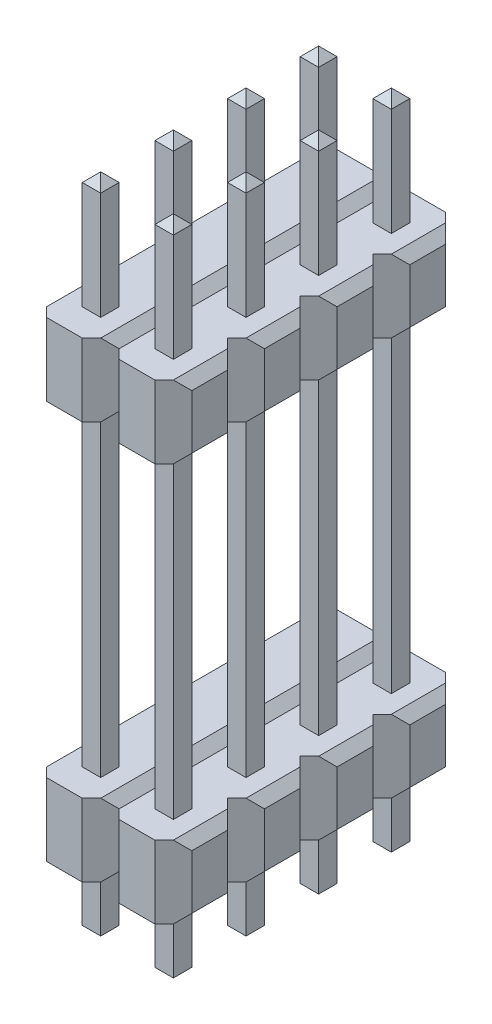
from build123d import *

# Parameters (mm, degrees)
SKETCH1_W                  = 1.99898
SKETCH1_H                  = 1.99898
BASE_EXTRUDE_DEPTH         = 1.99898
CHAMFER1_SIZE              = 0.254
CHAMFER2_SIZE              = 0.254
CHAMFER3_SIZE              = 0.508
CHAMFER4_SIZE              = 0.508
BOSS_EXTRUDE1_START        = -2.032
SKETCH2_W                  = 0.508
SKETCH2_H                  = 0.508
BOSS_EXTRUDE1_DEPTH        = 18.2118
LPATTERN1_START            = -6.99643
LPATTERN1_DEPTH            = 5.99694
LPATTERN1_START_2          = -0.99949
LPATTERN1_2_DEPTH          = 1.99898
LPATTERN1_START_3          = 2.467774382
LPATTERN1_3_OUTLINE_W      = 1.413492313
LPATTERN1_3_OUTLINE_H      = 1.99898
LPATTERN1_3_OUTLINE_W_2    = 0.718420489
LPATTERN1_3_DEPTH          = 0.71842049
LPATTERN1_START_4          = 0.359210245
LPATTERN1_4_OUTLINE_W      = 1.532225618
LPATTERN1_4_OUTLINE_H      = 1.99898
LPATTERN1_4_OUTLINE_W_2    = 1.705240991
LPATTERN1_4_DEPTH          = 4.24047694
LPATTERN1_START_5          = 5.294759009
LPATTERN1_5_OUTLINE_W      = 0.718420489
LPATTERN1_5_OUTLINE_H      = 1.99898
LPATTERN1_5_OUTLINE_W_2    = 1.413492313
LPATTERN1_5_DEPTH          = 1.413492313
LPATTERN1_START_6          = 1.054282069
LPATTERN1_6_OUTLINE_W      = 0.71842049
LPATTERN1_6_OUTLINE_H      = 1.99898
LPATTERN1_6_DEPTH          = 0.718420489
LPATTERN1_START_7          = 3.881266696
LPATTERN1_7_OUTLINE_W      = 0.71842049
LPATTERN1_7_OUTLINE_H      = 1.99898
LPATTERN1_7_DEPTH          = 0.718420489
LPATTERN1_START_8          = -1.054282069
LPATTERN1_8_OUTLINE_W      = 1.413492313
LPATTERN1_8_OUTLINE_H      = 1.99898
LPATTERN1_8_OUTLINE_W_2    = 0.718420489
LPATTERN1_8_DEPTH          = 1.413492314
LPATTERN1_START_9          = 6.708251322
LPATTERN1_9_OUTLINE_W      = 0.71842049
LPATTERN1_9_OUTLINE_H      = 1.99898
LPATTERN1_9_DEPTH          = 1.291748678
CHAMFER5_SIZE              = 0.254
LPATTERN2_COUNT            = 2
LPATTERN2_PITCH            = 1.99898
LPATTERN2_COUNT_DIR2       = 4
LPATTERN2_PITCH_DIR2       = 1.99898
CHAMFER5_OF_LPATTERN2_SIZE = 0.254
LPATTERN4_START            = -6.99643
LPATTERN4_DEPTH            = 7.99592
LPATTERN4_START_2          = -1.772702558
LPATTERN4_2_OUTLINE_W      = 1.413492314
LPATTERN4_2_OUTLINE_H      = 1.99898
LPATTERN4_2_OUTLINE_W_2    = 0.71842049
LPATTERN4_2_OUTLINE_W_3    = 1.413492313
LPATTERN4_2_DEPTH          = 0.718420489
LPATTERN4_START_3          = -0.359210245
LPATTERN4_3_OUTLINE_W      = 1.945717931
LPATTERN4_3_OUTLINE_H      = 1.99898
LPATTERN4_3_OUTLINE_W_2    = 0.718420489
LPATTERN4_3_DEPTH          = 0.71842049
LPATTERN4_START_4          = -3.186194872
LPATTERN4_4_OUTLINE_W      = 0.718420489
LPATTERN4_4_OUTLINE_H      = 1.99898
LPATTERN4_4_OUTLINE_W_2    = 1.291748678
LPATTERN4_4_DEPTH          = 0.71842049
LPATTERN4_START_5          = -5.294759009
LPATTERN4_5_OUTLINE_W      = 0.71842049
LPATTERN4_5_OUTLINE_H      = 1.99898
LPATTERN4_5_OUTLINE_W_2    = 1.413492313
LPATTERN4_5_DEPTH          = 1.413492313
LPATTERN4_START_6          = 1.054282069
LPATTERN4_6_OUTLINE_W      = 1.413492314
LPATTERN4_6_OUTLINE_H      = 1.99898
LPATTERN4_6_OUTLINE_W_2    = 0.71842049
LPATTERN4_6_DEPTH          = 1.413492313
LPATTERN4_START_7          = -7
LPATTERN4_7_OUTLINE_W      = 0.718420489
LPATTERN4_7_OUTLINE_H      = 1.99898
LPATTERN4_7_DEPTH          = 1.705240991
LPATTERN4_START_8          = 2.467774382
LPATTERN4_8_OUTLINE_W      = 0.718420489
LPATTERN4_8_OUTLINE_H      = 1.99898
LPATTERN4_8_DEPTH          = 1.532225618


with BuildPart() as part:
    # Sketch1 → Base-Extrude (new body)
    with BuildSketch(Plane(origin=(0, 0, 0), x_dir=(1, 0, 0), z_dir=(0, 1, 0))):
        Rectangle(SKETCH1_W, SKETCH1_H)
    extrude(amount=BASE_EXTRUDE_DEPTH)

    # Chamfer1
    chamfer1_edges = [part.edges().sort_by_distance(p)[0] for p in [
        (0.99949, 1.99898, 0),
        (-0.99949, 1.99898, 0),
    ]]
    chamfer(chamfer1_edges, length=CHAMFER1_SIZE)

    # Chamfer2
    chamfer2_edges = [part.edges().sort_by_distance(p)[0] for p in [
        (0.99949, 0, 0),
        (-0.99949, 0, 0),
    ]]
    chamfer(chamfer2_edges, length=CHAMFER2_SIZE)

    # Chamfer3
    chamfer3_edges = [part.edges().sort_by_distance(p)[0] for p in [
        (0.99949, 0.99949, 0.99949),
        (-0.99949, 0.99949, 0.99949),
    ]]
    chamfer(chamfer3_edges, length=CHAMFER3_SIZE)

    # Chamfer4
    chamfer4_edges = [part.edges().sort_by_distance(p)[0] for p in [
        (-0.99949, 0.99949, -0.99949),
        (0.99949, 0.99949, -0.99949),
    ]]
    chamfer(chamfer4_edges, length=CHAMFER4_SIZE)

    # Sketch2 → Boss-Extrude1 (add)
    with BuildSketch(Plane(origin=(0, 0, 0), x_dir=(-1, 0, 0), z_dir=(0, 1, 0)).offset(BOSS_EXTRUDE1_START)):
        Rectangle(SKETCH2_W, SKETCH2_H)
    boss_extrude1 = extrude(amount=BOSS_EXTRUDE1_DEPTH)

    # LPattern1: read off the stored shape, not the designer's step
    # LPattern1 outline → LPattern1 (add)
    with BuildSketch(Plane.XY.offset(LPATTERN1_START)):
        Polygon((-0.99949, 1.74498), (-0.99949, 0.254), (-0.74549, 0), (0.74549, 0), (0.99949, 0.254), (1.25349, 0), (2.74447, 0), (2.99847, 0.254), (2.99847, 1.74498), (2.74447, 1.99898), (1.25349, 1.99898), (0.99949, 1.74498), (0.74549, 1.99898), (-0.74549, 1.99898), align=None)
    extrude(amount=LPATTERN1_DEPTH)

    # LPattern1 2 outline → LPattern1 2 (add)
    with BuildSketch(Plane.XY.offset(LPATTERN1_START_2)):
        Polygon((0.99949, 1.74498), (0.99949, 0.254), (1.25349, 0), (2.74447, 0), (2.99847, 0.254), (2.99847, 1.74498), (2.74447, 1.99898), (1.25349, 1.99898), align=None)
    extrude(amount=LPATTERN1_2_DEPTH)

    # LPattern1 3 outline → LPattern1 3 (cut)
    with BuildSketch(Plane(origin=(0, 0, 0), x_dir=(0.707106781186548, 0, 0.707106781186547), z_dir=(0.707106781186547, 0, -0.707106781186548)).offset(LPATTERN1_START_3)):
        with Locations((1.761028226, -0.99949)):
            Rectangle(LPATTERN1_3_OUTLINE_W, LPATTERN1_3_OUTLINE_H)
        with Locations((-1.413492314, -0.99949)):
            Rectangle(LPATTERN1_3_OUTLINE_W_2, LPATTERN1_3_OUTLINE_H)
        with Locations((-4.588012853, -0.99949)):
            Rectangle(LPATTERN1_3_OUTLINE_W, LPATTERN1_3_OUTLINE_H)
    extrude(amount=LPATTERN1_3_DEPTH, mode=Mode.SUBTRACT)

    # LPattern1 4 outline → LPattern1 4 (cut)
    with BuildSketch(Plane(origin=(0, 0, 0), x_dir=(0.707106781186548, 0, 0.707106781186547), z_dir=(0.707106781186547, 0, -0.707106781186548)).offset(LPATTERN1_START_4)):
        with Locations((3.233887191, -0.99949)):
            Rectangle(LPATTERN1_4_OUTLINE_W, LPATTERN1_4_OUTLINE_H)
        with Locations((-6.147379504, -0.99949)):
            Rectangle(LPATTERN1_4_OUTLINE_W_2, LPATTERN1_4_OUTLINE_H)
    extrude(amount=LPATTERN1_4_DEPTH, mode=Mode.SUBTRACT)

    # LPattern1 5 outline → LPattern1 5 (cut)
    with BuildSketch(Plane(origin=(0, 0, 0), x_dir=(0.707106781186548, 0, 0.707106781186547), z_dir=(0.707106781186547, 0, -0.707106781186548)).offset(LPATTERN1_START_5)):
        with Locations((-1.413492314, -0.99949)):
            Rectangle(LPATTERN1_5_OUTLINE_W, LPATTERN1_5_OUTLINE_H)
        with Locations((-4.588012853, -0.99949)):
            Rectangle(LPATTERN1_5_OUTLINE_W_2, LPATTERN1_5_OUTLINE_H)
    extrude(amount=LPATTERN1_5_DEPTH, mode=Mode.SUBTRACT)

    # LPattern1 6 outline → LPattern1 6 (cut)
    with BuildSketch(Plane(origin=(0, 0, 0), x_dir=(0.707106781186548, 0, 0.707106781186547), z_dir=(0.707106781186547, 0, -0.707106781186548)).offset(LPATTERN1_START_6)):
        with Locations((0, -0.99949)):
            Rectangle(LPATTERN1_6_OUTLINE_W, LPATTERN1_6_OUTLINE_H)
        with Locations((-2.826984627, -0.99949)):
            Rectangle(LPATTERN1_6_OUTLINE_W, LPATTERN1_6_OUTLINE_H)
    extrude(amount=LPATTERN1_6_DEPTH, mode=Mode.SUBTRACT)

    # LPattern1 7 outline → LPattern1 7 (cut)
    with BuildSketch(Plane(origin=(0, 0, 0), x_dir=(0.707106781186548, 0, 0.707106781186547), z_dir=(0.707106781186547, 0, -0.707106781186548)).offset(LPATTERN1_START_7)):
        with Locations((0, -0.99949)):
            Rectangle(LPATTERN1_7_OUTLINE_W, LPATTERN1_7_OUTLINE_H)
        with Locations((-2.826984627, -0.99949)):
            Rectangle(LPATTERN1_7_OUTLINE_W, LPATTERN1_7_OUTLINE_H)
    extrude(amount=LPATTERN1_7_DEPTH, mode=Mode.SUBTRACT)

    # LPattern1 8 outline → LPattern1 8 (cut)
    with BuildSketch(Plane(origin=(0, 0, 0), x_dir=(0.707106781186548, 0, 0.707106781186547), z_dir=(0.707106781186547, 0, -0.707106781186548)).offset(LPATTERN1_START_8)):
        with Locations((1.761028226, -0.99949)):
            Rectangle(LPATTERN1_8_OUTLINE_W, LPATTERN1_8_OUTLINE_H)
        with Locations((-1.413492314, -0.99949)):
            Rectangle(LPATTERN1_8_OUTLINE_W_2, LPATTERN1_8_OUTLINE_H)
    extrude(amount=LPATTERN1_8_DEPTH, mode=Mode.SUBTRACT)

    # LPattern1 9 outline → LPattern1 9 (cut)
    with BuildSketch(Plane(origin=(0, 0, 0), x_dir=(0.707106781186548, 0, 0.707106781186547), z_dir=(0.707106781186547, 0, -0.707106781186548)).offset(LPATTERN1_START_9)):
        with Locations((-2.826984627, -0.99949)):
            Rectangle(LPATTERN1_9_OUTLINE_W, LPATTERN1_9_OUTLINE_H)
    extrude(amount=LPATTERN1_9_DEPTH, mode=Mode.SUBTRACT)

    # Chamfer5
    chamfer5_edges = [part.edges().sort_by_distance(p)[0] for p in [
        (-0.254, -2.032, 0),
        (0, -2.032, -0.254),
        (0.254, -2.032, 0),
        (0, -2.032, 0.254),
        (-0.254, 16.1798, 0),
        (0, 16.1798, 0.254),
        (0.254, 16.1798, 0),
        (0, 16.1798, -0.254),
    ]]
    chamfer(chamfer5_edges, length=CHAMFER5_SIZE - 0.0001)  # a hair under: the kernel refuses the full size

    # LPattern2: Boss-Extrude1 2 × 4
    with Locations(*[(i * LPATTERN2_PITCH, 0, -j * LPATTERN2_PITCH_DIR2) for i in range(LPATTERN2_COUNT) for j in range(LPATTERN2_COUNT_DIR2) if (i, j) != (0, 0)]):
        add(boss_extrude1)

    # Chamfer5 of LPattern2
    chamfer5_of_lpattern2_edges = [part.edges().sort_by_distance(p)[0] for p in [
        (-0.254, -2.032, -1.99898),
        (0, -2.032, -2.25298),
        (0.254, -2.032, -1.99898),
        (0, -2.032, -1.74498),
        (-0.254, 16.1798, -1.99898),
        (0, 16.1798, -1.74498),
        (0.254, 16.1798, -1.99898),
        (0, 16.1798, -2.25298),
        (-0.254, -2.032, -3.99796),
        (0, -2.032, -4.25196),
        (0.254, -2.032, -3.99796),
        (0, -2.032, -3.74396),
        (-0.254, 16.1798, -3.99796),
        (0, 16.1798, -3.74396),
        (0.254, 16.1798, -3.99796),
        (0, 16.1798, -4.25196),
        (-0.254, -2.032, -5.99694),
        (0, -2.032, -6.25094),
        (0.254, -2.032, -5.99694),
        (0, -2.032, -5.74294),
        (-0.254, 16.1798, -5.99694),
        (0, 16.1798, -5.74294),
        (0.254, 16.1798, -5.99694),
        (0, 16.1798, -6.25094),
        (1.74498, -2.032, 0),
        (1.99898, -2.032, -0.254),
        (2.25298, -2.032, 0),
        (1.99898, -2.032, 0.254),
        (1.74498, 16.1798, 0),
        (1.99898, 16.1798, 0.254),
        (2.25298, 16.1798, 0),
        (1.99898, 16.1798, -0.254),
        (1.74498, -2.032, -1.99898),
        (1.99898, -2.032, -2.25298),
        (2.25298, -2.032, -1.99898),
        (1.99898, -2.032, -1.74498),
        (1.74498, 16.1798, -1.99898),
        (1.99898, 16.1798, -1.74498),
        (2.25298, 16.1798, -1.99898),
        (1.99898, 16.1798, -2.25298),
        (1.74498, -2.032, -3.99796),
        (1.99898, -2.032, -4.25196),
        (2.25298, -2.032, -3.99796),
        (1.99898, -2.032, -3.74396),
        (1.74498, 16.1798, -3.99796),
        (1.99898, 16.1798, -3.74396),
        (2.25298, 16.1798, -3.99796),
        (1.99898, 16.1798, -4.25196),
        (1.74498, -2.032, -5.99694),
        (1.99898, -2.032, -6.25094),
        (2.25298, -2.032, -5.99694),
        (1.99898, -2.032, -5.74294),
        (1.74498, 16.1798, -5.99694),
        (1.99898, 16.1798, -5.74294),
        (2.25298, 16.1798, -5.99694),
        (1.99898, 16.1798, -6.25094),
    ]]
    chamfer(chamfer5_of_lpattern2_edges, length=CHAMFER5_OF_LPATTERN2_SIZE - 0.0001)  # a hair under: the kernel refuses the full size

    # LPattern4: read off the stored shape, not the designer's step
    # LPattern4 outline → LPattern4 (add)
    with BuildSketch(Plane.XY.offset(LPATTERN4_START)):
        Polygon((-0.99949, 12.71016), (-0.99949, 11.21918), (-0.74549, 10.96518), (0.74549, 10.96518), (0.99949, 11.21918), (1.25349, 10.96518), (2.74447, 10.96518), (2.99847, 11.21918), (2.99847, 12.71016), (2.74447, 12.96416), (1.25349, 12.96416), (0.99949, 12.71016), (0.74549, 12.96416), (-0.74549, 12.96416), align=None)
    extrude(amount=LPATTERN4_DEPTH)

    # LPattern4 2 outline → LPattern4 2 (cut)
    with BuildSketch(Plane(origin=(0, 0, 0), x_dir=(0.7071067811865471, 0, -0.707106781186548), z_dir=(0.707106781186548, 0, 0.707106781186547)).offset(LPATTERN4_START_2)):
        with Locations((-0.347535912, 11.96467)):
            Rectangle(LPATTERN4_2_OUTLINE_W, LPATTERN4_2_OUTLINE_H)
        with Locations((2.826984627, 11.96467)):
            Rectangle(LPATTERN4_2_OUTLINE_W_2, LPATTERN4_2_OUTLINE_H)
        with Locations((6.001505166, 11.96467)):
            Rectangle(LPATTERN4_2_OUTLINE_W_3, LPATTERN4_2_OUTLINE_H)
    extrude(amount=LPATTERN4_2_DEPTH, mode=Mode.SUBTRACT)

    # LPattern4 3 outline → LPattern4 3 (cut)
    with BuildSketch(Plane(origin=(0, 0, 0), x_dir=(0.7071067811865471, 0, -0.707106781186548), z_dir=(0.707106781186548, 0, 0.707106781186547)).offset(LPATTERN4_START_3)):
        with Locations((-2.027141035, 11.96467)):
            Rectangle(LPATTERN4_3_OUTLINE_W, LPATTERN4_3_OUTLINE_H)
        with Locations((1.413492314, 11.96467)):
            Rectangle(LPATTERN4_3_OUTLINE_W_2, LPATTERN4_3_OUTLINE_H)
        with Locations((4.240476941, 11.96467)):
            Rectangle(LPATTERN4_3_OUTLINE_W_2, LPATTERN4_3_OUTLINE_H)
    extrude(amount=LPATTERN4_3_DEPTH, mode=Mode.SUBTRACT)

    # LPattern4 4 outline → LPattern4 4 (cut)
    with BuildSketch(Plane(origin=(0, 0, 0), x_dir=(0.7071067811865471, 0, -0.707106781186548), z_dir=(0.707106781186548, 0, 0.707106781186547)).offset(LPATTERN4_START_4)):
        with Locations((1.413492314, 11.96467)):
            Rectangle(LPATTERN4_4_OUTLINE_W, LPATTERN4_4_OUTLINE_H)
        with Locations((4.240476941, 11.96467)):
            Rectangle(LPATTERN4_4_OUTLINE_W, LPATTERN4_4_OUTLINE_H)
        with Locations((7.354125661, 11.96467)):
            Rectangle(LPATTERN4_4_OUTLINE_W_2, LPATTERN4_4_OUTLINE_H)
    extrude(amount=LPATTERN4_4_DEPTH, mode=Mode.SUBTRACT)

    # LPattern4 5 outline → LPattern4 5 (cut)
    with BuildSketch(Plane(origin=(0, 0, 0), x_dir=(0.7071067811865471, 0, -0.707106781186548), z_dir=(0.707106781186548, 0, 0.707106781186547)).offset(LPATTERN4_START_5)):
        with Locations((2.826984627, 11.96467)):
            Rectangle(LPATTERN4_5_OUTLINE_W, LPATTERN4_5_OUTLINE_H)
        with Locations((6.001505166, 11.96467)):
            Rectangle(LPATTERN4_5_OUTLINE_W_2, LPATTERN4_5_OUTLINE_H)
    extrude(amount=LPATTERN4_5_DEPTH, mode=Mode.SUBTRACT)

    # LPattern4 6 outline → LPattern4 6 (cut)
    with BuildSketch(Plane(origin=(0, 0, 0), x_dir=(0.7071067811865471, 0, -0.707106781186548), z_dir=(0.707106781186548, 0, 0.707106781186547)).offset(LPATTERN4_START_6)):
        with Locations((-0.347535912, 11.96467)):
            Rectangle(LPATTERN4_6_OUTLINE_W, LPATTERN4_6_OUTLINE_H)
        with Locations((2.826984627, 11.96467)):
            Rectangle(LPATTERN4_6_OUTLINE_W_2, LPATTERN4_6_OUTLINE_H)
    extrude(amount=LPATTERN4_6_DEPTH, mode=Mode.SUBTRACT)

    # LPattern4 7 outline → LPattern4 7 (cut)
    with BuildSketch(Plane(origin=(0, 0, 0), x_dir=(0.7071067811865471, 0, -0.707106781186548), z_dir=(0.707106781186548, 0, 0.707106781186547)).offset(LPATTERN4_START_7)):
        with Locations((4.240476941, 11.96467)):
            Rectangle(LPATTERN4_7_OUTLINE_W, LPATTERN4_7_OUTLINE_H)
    extrude(amount=LPATTERN4_7_DEPTH, mode=Mode.SUBTRACT)

    # LPattern4 8 outline → LPattern4 8 (cut)
    with BuildSketch(Plane(origin=(0, 0, 0), x_dir=(0.7071067811865471, 0, -0.707106781186548), z_dir=(0.707106781186548, 0, 0.707106781186547)).offset(LPATTERN4_START_8)):
        with Locations((1.413492314, 11.96467)):
            Rectangle(LPATTERN4_8_OUTLINE_W, LPATTERN4_8_OUTLINE_H)
    extrude(amount=LPATTERN4_8_DEPTH, mode=Mode.SUBTRACT)


solid = part.part
